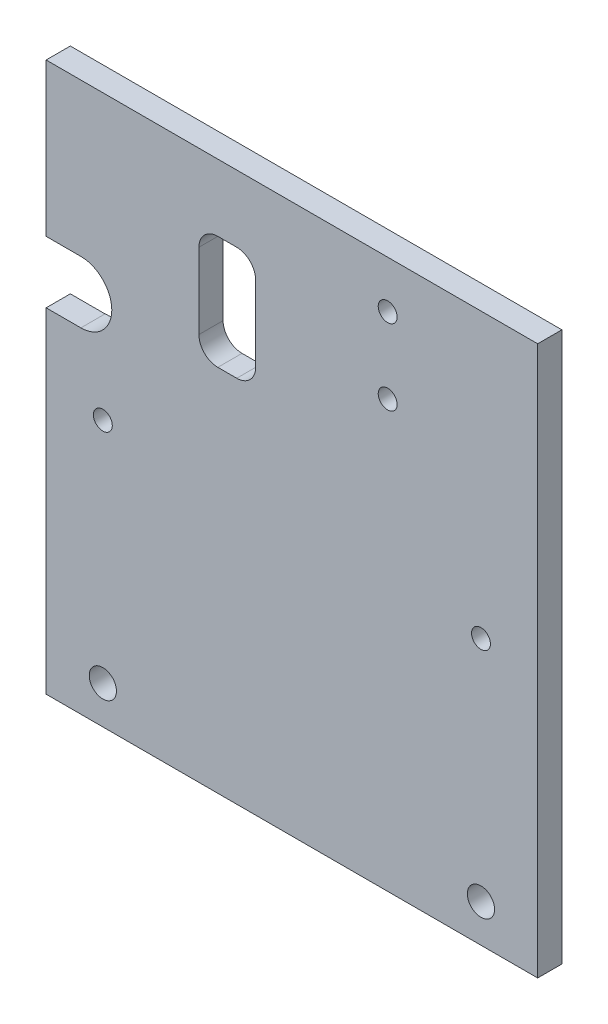
from build123d import *

# Parameters (mm, degrees)
SKETCH1_W           = 130
SKETCH1_H           = 145.26
SKETCH1_R           = 3.6
SKETCH1_R_2         = 2.5
BOSS_EXTRUDE1_DEPTH = 6.4
SKETCH2_R           = 2.5
CUT_EXTRUDE1_DEPTH  = 178.654798978
CUT_EXTRUDE2_DEPTH  = 178.654798978
CUT_EXTRUDE3_DEPTH  = 178.654798978


with BuildPart() as part:
    # Sketch1 → Boss-Extrude1 (new body)
    with BuildSketch(Plane.XY):
        with Locations((50, 62.63)):
            Rectangle(SKETCH1_W, SKETCH1_H)
        Circle(SKETCH1_R, mode=Mode.SUBTRACT)
        with Locations((0, 60.26)):
            Circle(SKETCH1_R_2, mode=Mode.SUBTRACT)
        with Locations((100, 60.26)):
            Circle(SKETCH1_R_2, mode=Mode.SUBTRACT)
        with Locations((100, 0)):
            Circle(SKETCH1_R, mode=Mode.SUBTRACT)
    extrude(amount=BOSS_EXTRUDE1_DEPTH)

    # Sketch2 → Cut-Extrude1 (cut, through all)
    with BuildSketch(Plane.XY.offset(6.4)):
        with Locations((75.33, 122.766411568)):
            Circle(SKETCH2_R)
        with Locations((75.33, 102.766411568)):
            Circle(SKETCH2_R)
    extrude(amount=-CUT_EXTRUDE1_DEPTH, mode=Mode.SUBTRACT)

    # Sketch3 → Cut-Extrude2 (cut, through all)
    with BuildSketch(Plane(origin=(0, 0, 0), x_dir=(-1, 0, 0), z_dir=(0, 0, -1))):
        with BuildLine():
            Line((-35.40754614, 117.570367495), (-30.40754614, 117.570367495))
            ThreePointArc((-30.40754614, 117.570367495), (-26.872012234, 116.105901401), (-25.40754614, 112.570367495))
            Line((-25.40754614, 112.570367495), (-25.40754614, 92.570367495))
            ThreePointArc((-25.40754614, 92.570367495), (-26.872012234, 89.034833589), (-30.40754614, 87.570367495))
            Line((-30.40754614, 87.570367495), (-35.40754614, 87.570367495))
            ThreePointArc((-35.40754614, 87.570367495), (-38.943080046, 89.034833589), (-40.40754614, 92.570367495))
            Line((-40.40754614, 92.570367495), (-40.40754614, 112.570367495))
            ThreePointArc((-40.40754614, 112.570367495), (-38.943080046, 116.105901401), (-35.40754614, 117.570367495))
        make_face()
    extrude(amount=-CUT_EXTRUDE2_DEPTH, mode=Mode.SUBTRACT)

    # Sketch4 → Cut-Extrude3 (cut, through all)
    with BuildSketch(Plane.XY.offset(6.4)):
        with BuildLine():
            Line((-15, 78.5), (-15, 94.86))
            Line((-15, 94.86), (-5.81, 94.86))
            ThreePointArc((-5.81, 94.86), (2.37, 86.68), (-5.81, 78.5))
            Line((-5.81, 78.5), (-15, 78.5))
        make_face()
    extrude(amount=-CUT_EXTRUDE3_DEPTH, mode=Mode.SUBTRACT)


solid = part.part
